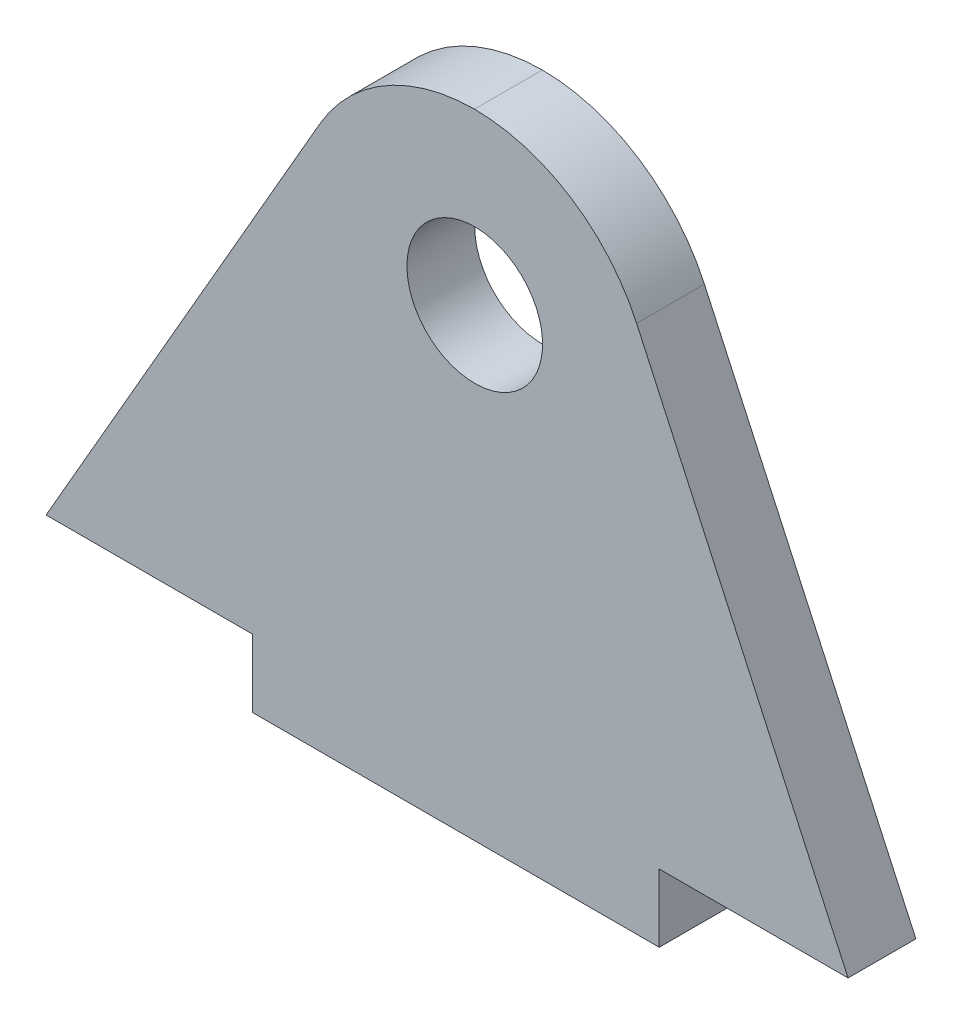
from build123d import *

# Parameters (mm, degrees)
SKETCH1_W                   = 62.178178995
SKETCH1_H                   = 55.159619557
BOSS_EXTRUDE1_DEPTH         = 3.175
F_1_4_0_25_DIAMETER_HOLE1_D = 6.35
CUT_EXTRUDE6_DEPTH          = 84.179265432
FILLET1_R                   = 8.382
SKETCH7_W                   = 19.05
SKETCH7_H                   = 3.175
BOSS_EXTRUDE2_DEPTH         = 3.175


with BuildPart() as part:
    # Sketch1 → Boss-Extrude1 (new body)
    with BuildSketch(Plane.XY):
        with Locations((-31.089089498, 27.579809779)):
            Rectangle(SKETCH1_W, SKETCH1_H)
    extrude(amount=BOSS_EXTRUDE1_DEPTH)

    # 1/4 (0.25) Diameter Hole1 (through all)
    with Locations(Plane(origin=(0, 0, 0), x_dir=(-1, 0, 0), z_dir=(0, 0, -1))):
        with Locations((42.112178995, 18.542)):
            Hole(F_1_4_0_25_DIAMETER_HOLE1_D / 2)

    # Sketch4 → Cut-Extrude6 (cut, through all)
    with BuildSketch(Plane(origin=(0, 0, 0), x_dir=(-1, 0, 0), z_dir=(0, 0, -1))):
        Polygon((46.938178995, 26.4795), (62.178178995, 0), (62.178178995, 55.159619557), (0, 55.159619557), (0, 0), (24.636978995, 0), (36.778178995, 26.4795), align=None)
    extrude(amount=-CUT_EXTRUDE6_DEPTH, mode=Mode.SUBTRACT)

    # Fillet1
    # the kernel refuses this fillet: 8.382 mm, written as the material it takes off along each edge
    with BuildSketch(Plane(origin=(-46.938178995, 26.4795, -12.117368839), x_dir=(-0.49882253176769886, -0.8667041489463767, 0), z_dir=(0, 0, 1))) as fillet1_piece_1:
        with BuildLine():
            CenterArc((FILLET1_R * 0.578256685216, FILLET1_R), FILLET1_R, 209.922129856, 60.077870144)
            Line((-FILLET1_R * 0.288447463731, FILLET1_R * 0.501177468232), (0, 0))
            Line((0, 0), (FILLET1_R * 0.578256685216, 0))
        make_face()
    extrude(amount=27.409737677, mode=Mode.SUBTRACT)
    with BuildSketch(Plane(origin=(-36.778178995, 26.4795, -13.444588142), x_dir=(0.41678981361521655, -0.9090028884808855, 0), z_dir=(0, 0, 1))) as fillet1_piece_2:
        with BuildLine():
            CenterArc((FILLET1_R * 0.641593325803, -FILLET1_R), FILLET1_R, 90, 65.367919757)
            Line((-FILLET1_R * 0.267409562678, -FILLET1_R * 0.583210186385), (0, 0))
            Line((0, 0), (FILLET1_R * 0.641593325803, 0))
        make_face()
    extrude(amount=30.064176284, mode=Mode.SUBTRACT)

    # Sketch7 → Boss-Extrude2 (add)
    with BuildSketch(Plane(origin=(0, 0, 0), x_dir=(-1, 0, 0), z_dir=(0, 0, -1))):
        with Locations((43.001178995, -1.5875)):
            Rectangle(SKETCH7_W, SKETCH7_H)
    extrude(amount=-BOSS_EXTRUDE2_DEPTH)


solid = part.part
